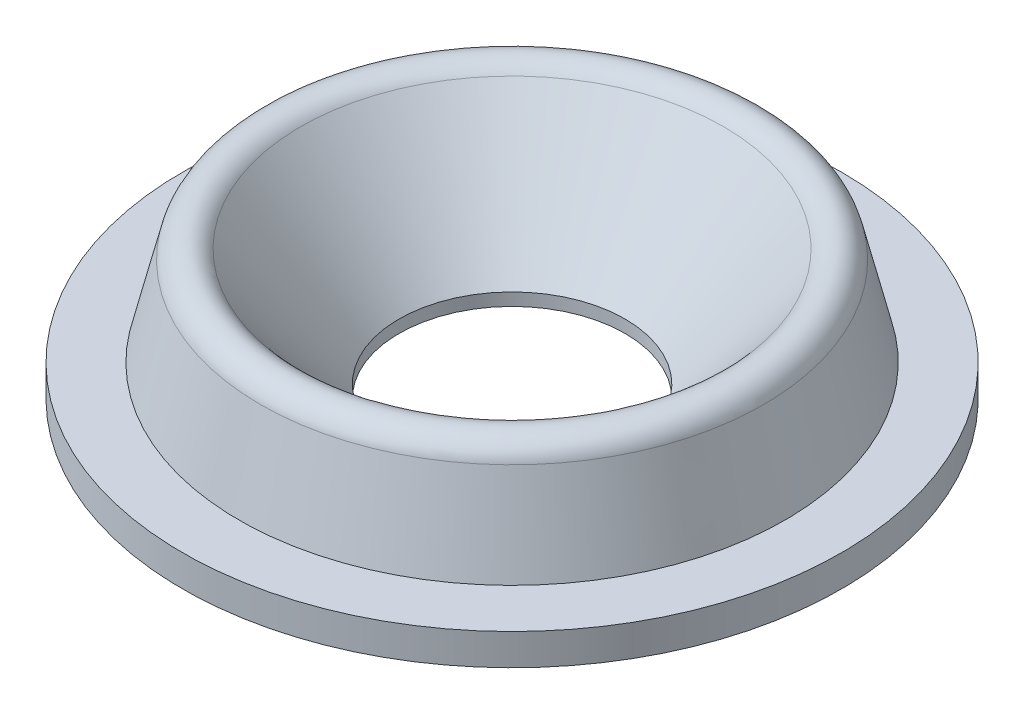
from build123d import *


# Read off the part's stored shape, not the designer's step: Shell2
with BuildPart() as part:
    # Sketch1 → Revolve1 (revolve)
    with BuildSketch(Plane.XY, mode=Mode.PRIVATE) as revolve1_sk:
        with BuildLine():
            Line((-6.6675, 0), (-6.6675, 0.635))
            Line((-6.6675, 0.635), (-5.5245, 0.635))
            Line((-5.5245, 0.635), (-5.086993169, 2.438135229))
            ThreePointArc((-5.086993169, 2.438135229), (-4.740640087, 2.78173227), (-4.277735634, 2.627658097))
            Line((-4.277735634, 2.627658097), (-2.286, 0.254))
            Line((-2.286, 0.254), (-2.286, 0))
            Line((-2.286, 0), (-6.6675, 0))
        make_face()
    revolve(revolve1_sk.sketch.rotate(Axis((0, 0, 0), (0, 1, 0)), 270), axis=Axis((0, 0, 0), (0, 1, 0)))

    # Shell2 outline → Shell2 (revolve, cut)
    with BuildSketch(Plane.XY):
        Polygon((4.861793391, 0), (4.468644562, 1.620318711), (3.10903573, 0), align=None)
    revolve(axis=Axis((0, 0, 0), (0, 1, 0)), mode=Mode.SUBTRACT)


solid = part.part
